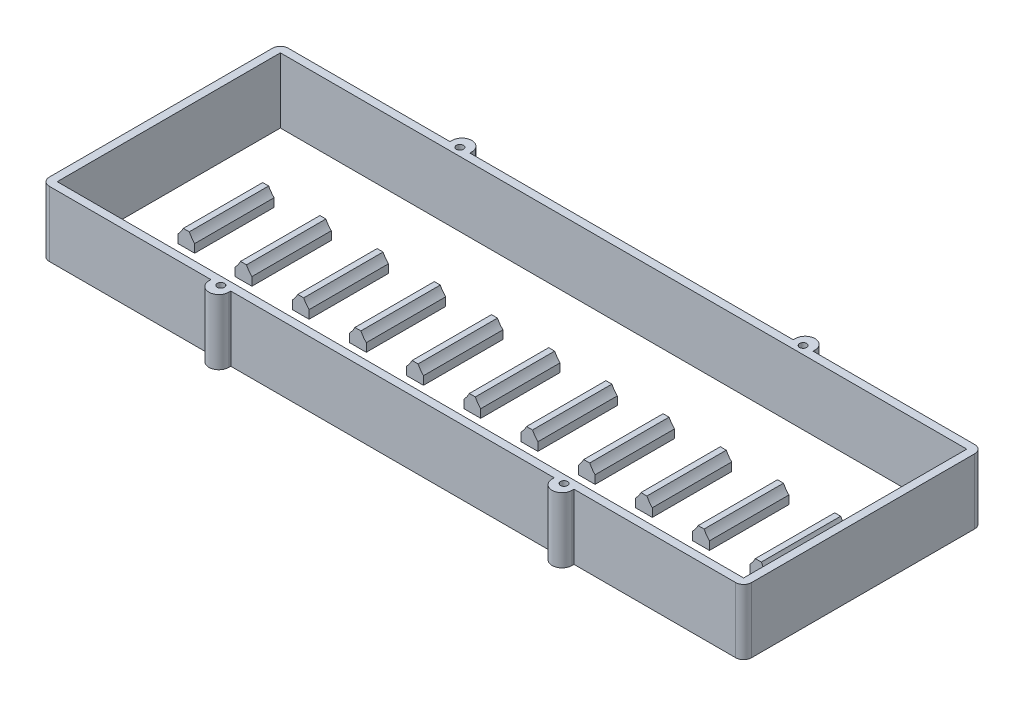
from build123d import *

# Parameters (mm, degrees)
BOSS_EXTRUDE1_OUTLINE_W        = 224.68
BOSS_EXTRUDE1_OUTLINE_H        = 76.48
BOSS_EXTRUDE1_OUTLINE_W_2      = 219.6
BOSS_EXTRUDE1_OUTLINE_H_2      = 71.4
BOSS_EXTRUDE1_DEPTH            = 20.839999976
BOSS_EXTRUDE2_DEPTH            = 12.7
LPATTERN2_COUNT                = 11
LPATTERN2_PITCH                = 18.3
SKETCH6_W                      = 6.35
SKETCH6_H                      = 3.81
BOSS_EXTRUDE3_DEPTH            = 20.839999976
MIRROR2_COPY_1_SKETCH_W        = 6.35
MIRROR2_COPY_1_SKETCH_H        = 3.81
MIRROR2_COPY_1_DEPTH           = 20.839999976
F_4_40_TAPPED_HOLE1_AT_2_COUNT = 2
F_4_40_TAPPED_HOLE1_AT_2_PITCH = 109.8
F_4_40_TAPPED_HOLE1_AT_3_COUNT = 2
F_4_40_TAPPED_HOLE1_AT_3_PITCH = 133.810427097
F_4_40_TAPPED_HOLE1_AT_4_COUNT = 2
F_4_40_TAPPED_HOLE1_AT_4_PITCH = 76.48
FILLET1_RADIUS                 = 3.175
FILLET1_LENGTH                 = 20.839999976
FILLET2_RADIUS                 = 3.175
FILLET2_LENGTH                 = 20.839999976
FILLET3_RADIUS                 = 3.175
FILLET3_LENGTH                 = 20.839999976
FILLET4_RADIUS                 = 3.175
FILLET4_LENGTH                 = 20.839999976
FILLET5_R                      = 2.54


# Read off the part's stored shape, not the designer's step: Boss-Extrude1
with BuildPart() as part:
    # Boss-Extrude1 outline → Boss-Extrude1 (new body)
    with BuildSketch(Plane(origin=(0, 0, 0), x_dir=(1, 0, 0), z_dir=(0, 1, 0))):
        Rectangle(BOSS_EXTRUDE1_OUTLINE_W, BOSS_EXTRUDE1_OUTLINE_H)
        Rectangle(BOSS_EXTRUDE1_OUTLINE_W_2, BOSS_EXTRUDE1_OUTLINE_H_2, mode=Mode.SUBTRACT)
    extrude(amount=BOSS_EXTRUDE1_DEPTH)

    # Sketch6 → Boss-Extrude3 (add)
    with BuildSketch(Plane(origin=(0, 20.839999976, 0), x_dir=(1, 0, 0), z_dir=(0, 1, 0))):
        with Locations((-54.9, 40.145)):
            Rectangle(SKETCH6_W, SKETCH6_H)
    boss_extrude3 = extrude(amount=-BOSS_EXTRUDE3_DEPTH)

    # Mirror1: Boss-Extrude3 across plane
    add(boss_extrude3.mirror(Plane(origin=(0, 0, 0), x_dir=(0, 0, 1), z_dir=(1, 0, 0))))

    # Mirror2: Boss-Extrude3 across plane
    add(boss_extrude3.mirror(Plane.XY))

    # Mirror2 copy 1 sketch → Mirror2 copy 1 (add)
    with BuildSketch(Plane(origin=(0, 20.839999976, 0), x_dir=(-1, 0, 0), z_dir=(0, 1, 0))):
        with Locations((-54.9, 40.145)):
            Rectangle(MIRROR2_COPY_1_SKETCH_W, MIRROR2_COPY_1_SKETCH_H)
    extrude(amount=-MIRROR2_COPY_1_DEPTH)

    # Sketch7 → #4-40 Tapped Hole1 (revolve, cut)
    with BuildSketch(Plane(origin=(-54.9, 20.839999976, -38.24), x_dir=(0, 0, 1), z_dir=(1, 0, 0))):
        Polygon((0, 0), (0, 8.299152758), (1.1303, 7.62), (1.1303, 0), align=None)
    f_4_40_tapped_hole1 = revolve(axis=Axis((-54.9, 27.189999976, -38.24), (0, -1, 0)), mode=Mode.SUBTRACT)

    # #4-40 Tapped Hole1 at 2: #4-40 Tapped Hole1 ×2
    with Locations(*[(i * F_4_40_TAPPED_HOLE1_AT_2_PITCH, 0, 0) for i in range(1, F_4_40_TAPPED_HOLE1_AT_2_COUNT)]):
        add(f_4_40_tapped_hole1, mode=Mode.SUBTRACT)

    # #4-40 Tapped Hole1 at 3: #4-40 Tapped Hole1 ×2
    with Locations(*[Vector(0.8205638557602251, 0, 0.5715548605513844) * (i * F_4_40_TAPPED_HOLE1_AT_3_PITCH) for i in range(1, F_4_40_TAPPED_HOLE1_AT_3_COUNT)]):
        add(f_4_40_tapped_hole1, mode=Mode.SUBTRACT)

    # #4-40 Tapped Hole1 at 4: #4-40 Tapped Hole1 ×2
    with Locations(*[(0, 0, i * F_4_40_TAPPED_HOLE1_AT_4_PITCH) for i in range(1, F_4_40_TAPPED_HOLE1_AT_4_COUNT)]):
        add(f_4_40_tapped_hole1, mode=Mode.SUBTRACT)

    # Fillet1: full round fillet: the end face becomes a half cylinder, R = half its width
    fillet1_face = Plane((-54.9, 10.419999988, -42.05), x_dir=(0, -1, 0), z_dir=(0, 0, -1))  # on the end face: x along it, z out of the body
    fillet1_slab = fillet1_face.offset(-FILLET1_RADIUS / 2) * Box(FILLET1_LENGTH, 2 * FILLET1_RADIUS, FILLET1_RADIUS, mode=Mode.PRIVATE)  # the body's end, R deep
    fillet1_round = Plane((-54.9, 10.419999988, -38.875), x_dir=(0, 0, -1), z_dir=(0, -1, 0)) * Cylinder(FILLET1_RADIUS, FILLET1_LENGTH, mode=Mode.PRIVATE)  # its axis R under the face
    add(fillet1_slab - fillet1_round, mode=Mode.SUBTRACT)

    # Fillet2: full round fillet: the end face becomes a half cylinder, R = half its width
    fillet2_face = Plane((54.9, 10.419999988, -42.05), x_dir=(0, -1, 0), z_dir=(0, 0, -1))  # on the end face: x along it, z out of the body
    fillet2_slab = fillet2_face.offset(-FILLET2_RADIUS / 2) * Box(FILLET2_LENGTH, 2 * FILLET2_RADIUS, FILLET2_RADIUS, mode=Mode.PRIVATE)  # the body's end, R deep
    fillet2_round = Plane((54.9, 10.419999988, -38.875), x_dir=(0, 0, -1), z_dir=(0, -1, 0)) * Cylinder(FILLET2_RADIUS, FILLET2_LENGTH, mode=Mode.PRIVATE)  # its axis R under the face
    add(fillet2_slab - fillet2_round, mode=Mode.SUBTRACT)

    # Fillet3: full round fillet: the end face becomes a half cylinder, R = half its width
    fillet3_face = Plane((54.9, 10.419999988, 42.05), x_dir=(0, -1, 0), z_dir=(0, 0, 1))  # on the end face: x along it, z out of the body
    fillet3_slab = fillet3_face.offset(-FILLET3_RADIUS / 2) * Box(FILLET3_LENGTH, 2 * FILLET3_RADIUS, FILLET3_RADIUS, mode=Mode.PRIVATE)  # the body's end, R deep
    fillet3_round = Plane((54.9, 10.419999988, 38.875), x_dir=(0, 0, 1), z_dir=(0, -1, 0)) * Cylinder(FILLET3_RADIUS, FILLET3_LENGTH, mode=Mode.PRIVATE)  # its axis R under the face
    add(fillet3_slab - fillet3_round, mode=Mode.SUBTRACT)

    # Fillet4: full round fillet: the end face becomes a half cylinder, R = half its width
    fillet4_face = Plane((-54.9, 10.419999988, 42.05), x_dir=(0, -1, 0), z_dir=(0, 0, 1))  # on the end face: x along it, z out of the body
    fillet4_slab = fillet4_face.offset(-FILLET4_RADIUS / 2) * Box(FILLET4_LENGTH, 2 * FILLET4_RADIUS, FILLET4_RADIUS, mode=Mode.PRIVATE)  # the body's end, R deep
    fillet4_round = Plane((-54.9, 10.419999988, 38.875), x_dir=(0, 0, 1), z_dir=(0, -1, 0)) * Cylinder(FILLET4_RADIUS, FILLET4_LENGTH, mode=Mode.PRIVATE)  # its axis R under the face
    add(fillet4_slab - fillet4_round, mode=Mode.SUBTRACT)

    # Fillet5
    fillet5_edges = [part.edges().sort_by_distance(p)[0] for p in [
        (112.34, 10.419999988, 38.24),
        (112.34, 10.419999988, -38.24),
        (-112.34, 10.419999988, -38.24),
        (-112.34, 10.419999988, 38.24),
    ]]
    fillet(fillet5_edges, radius=FILLET5_R)


with BuildPart() as body_2:
    # Sketch4 → Boss-Extrude2 (new, symmetric)
    with BuildSketch(Plane.XY):
        with BuildLine():
            Line((-94.179972952, 0), (-88.820027048, 0))
            Line((-88.820027048, 0), (-88.820027048, 2.679972952))
            ThreePointArc((-88.820027048, 2.679972952), (-89.780046898, 3.809877988), (-90.54497407, 5.08))
            Line((-90.54497407, 5.08), (-92.45502593, 5.08))
            ThreePointArc((-92.45502593, 5.08), (-93.219953102, 3.809877988), (-94.179972952, 2.679972952))
            Line((-94.179972952, 2.679972952), (-94.179972952, 0))
        make_face()
    extrude(amount=BOSS_EXTRUDE2_DEPTH, both=True)


with BuildPart() as lpattern2_1:
    # LPattern2: pattern copy
    add(body_2.part.moved(Location(Vector(1, 0, 0) * (1 * LPATTERN2_PITCH))))


with BuildPart() as lpattern2_2:
    # LPattern2: pattern copy
    add(body_2.part.moved(Location(Vector(1, 0, 0) * (2 * LPATTERN2_PITCH))))


with BuildPart() as lpattern2_3:
    # LPattern2: pattern copy
    add(body_2.part.moved(Location(Vector(1, 0, 0) * (3 * LPATTERN2_PITCH))))


with BuildPart() as lpattern2_4:
    # LPattern2: pattern copy
    add(body_2.part.moved(Location(Vector(1, 0, 0) * (4 * LPATTERN2_PITCH))))


with BuildPart() as lpattern2_5:
    # LPattern2: pattern copy
    add(body_2.part.moved(Location(Vector(1, 0, 0) * (5 * LPATTERN2_PITCH))))


with BuildPart() as lpattern2_6:
    # LPattern2: pattern copy
    add(body_2.part.moved(Location(Vector(1, 0, 0) * (6 * LPATTERN2_PITCH))))


with BuildPart() as lpattern2_7:
    # LPattern2: pattern copy
    add(body_2.part.moved(Location(Vector(1, 0, 0) * (7 * LPATTERN2_PITCH))))


with BuildPart() as lpattern2_8:
    # LPattern2: pattern copy
    add(body_2.part.moved(Location(Vector(1, 0, 0) * (8 * LPATTERN2_PITCH))))


with BuildPart() as lpattern2_9:
    # LPattern2: pattern copy
    add(body_2.part.moved(Location(Vector(1, 0, 0) * (9 * LPATTERN2_PITCH))))


with BuildPart() as lpattern2_10:
    # LPattern2: pattern copy
    add(body_2.part.moved(Location(Vector(1, 0, 0) * (10 * LPATTERN2_PITCH))))


solid = Compound([part.part, body_2.part, lpattern2_1.part, lpattern2_2.part, lpattern2_3.part, lpattern2_4.part, lpattern2_5.part, lpattern2_6.part, lpattern2_7.part, lpattern2_8.part, lpattern2_9.part, lpattern2_10.part])
